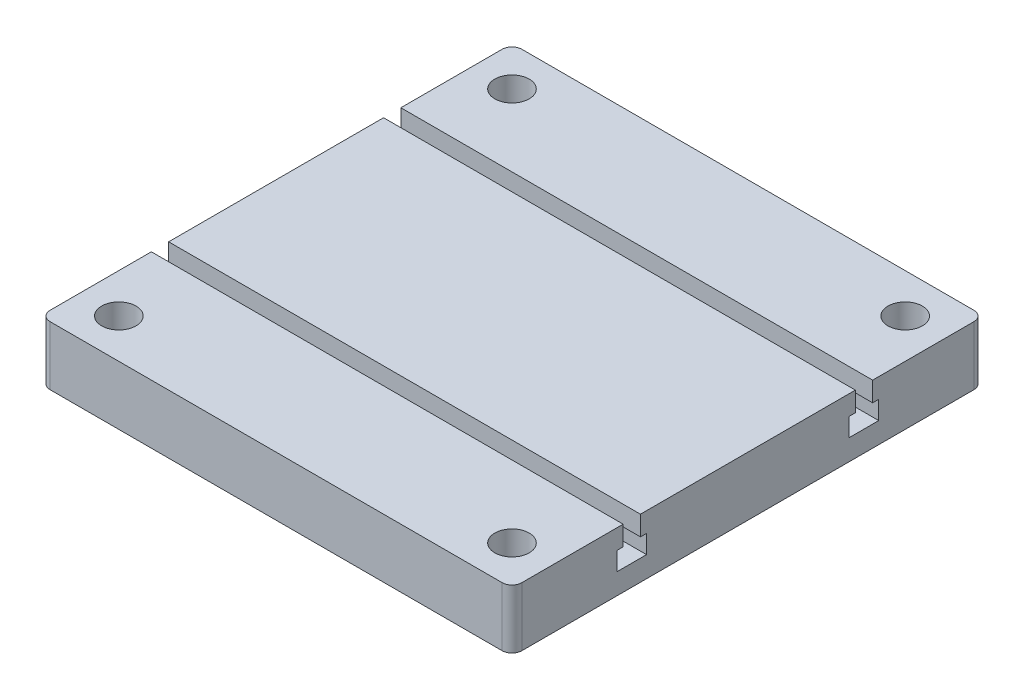
from build123d import *

# Parameters (mm, degrees)
SKETCH1_W                                        = 152.4
SKETCH1_H                                        = 152.4
BOSS_EXTRUDE1_DEPTH                              = 19.05
CBORE_FOR_1_4_SOCKET_HEAD_CAP_SCREW1_D           = 6.5278
CBORE_FOR_1_4_SOCKET_HEAD_CAP_SCREW1_CBORE_D     = 11.1125
CBORE_FOR_1_4_SOCKET_HEAD_CAP_SCREW1_CBORE_DEPTH = 8.89
T_SLOT_CUT_WITH_AMAZON_1_4_SLOT_CUTTER_DEPTH     = 172.45
FILLET1_R                                        = 3.175


with BuildPart() as part:
    # Sketch1 → Boss-Extrude1 (new body)
    with BuildSketch(Plane(origin=(0, 0, 0), x_dir=(1, 0, 0), z_dir=(0, 1, 0))):
        Rectangle(SKETCH1_W, SKETCH1_H)
    extrude(amount=BOSS_EXTRUDE1_DEPTH)

    # CBORE for 1/4 Socket Head Cap Screw1 (through all)
    with Locations(Plane(origin=(0, 19.05, 0), x_dir=(1, 0, 0), z_dir=(0, 1, 0))):
        with Locations((-63.5, 63.5), (63.5, 63.5), (63.5, -63.5), (-63.5, -63.5)):
            CounterBoreHole(CBORE_FOR_1_4_SOCKET_HEAD_CAP_SCREW1_D / 2, CBORE_FOR_1_4_SOCKET_HEAD_CAP_SCREW1_CBORE_D / 2, CBORE_FOR_1_4_SOCKET_HEAD_CAP_SCREW1_CBORE_DEPTH)

    # Sketch4 → T-SLOT CUT WITH AMAZON 1/4" SLOT CUTTER (cut, through all)
    with BuildSketch(Plane(origin=(-76.2, 0, 0), x_dir=(0, 0, -1), z_dir=(1, 0, 0))):
        Polygon((-40.2971, 19.05), (-40.2971, 12.7), (-42.2656, 12.7), (-42.2656, 6.746875), (-32.7406, 6.746875), (-32.7406, 12.7), (-34.7091, 12.7), (-34.7091, 19.05), align=None)
        Polygon((34.7091, 12.7), (34.7091, 19.05), (40.2971, 19.05), (40.2971, 12.7), (42.2656, 12.7), (42.2656, 6.746875), (32.7406, 6.746875), (32.7406, 12.7), align=None)
    extrude(amount=T_SLOT_CUT_WITH_AMAZON_1_4_SLOT_CUTTER_DEPTH, mode=Mode.SUBTRACT)

    # Fillet1
    fillet1_edges = [part.edges().sort_by_distance(p)[0] for p in [
        (-76.2, 9.525, 76.2),
        (76.2, 9.525, 76.2),
        (76.2, 9.525, -76.2),
        (-76.2, 9.525, -76.2),
    ]]
    fillet(fillet1_edges, radius=FILLET1_R)


solid = part.part
